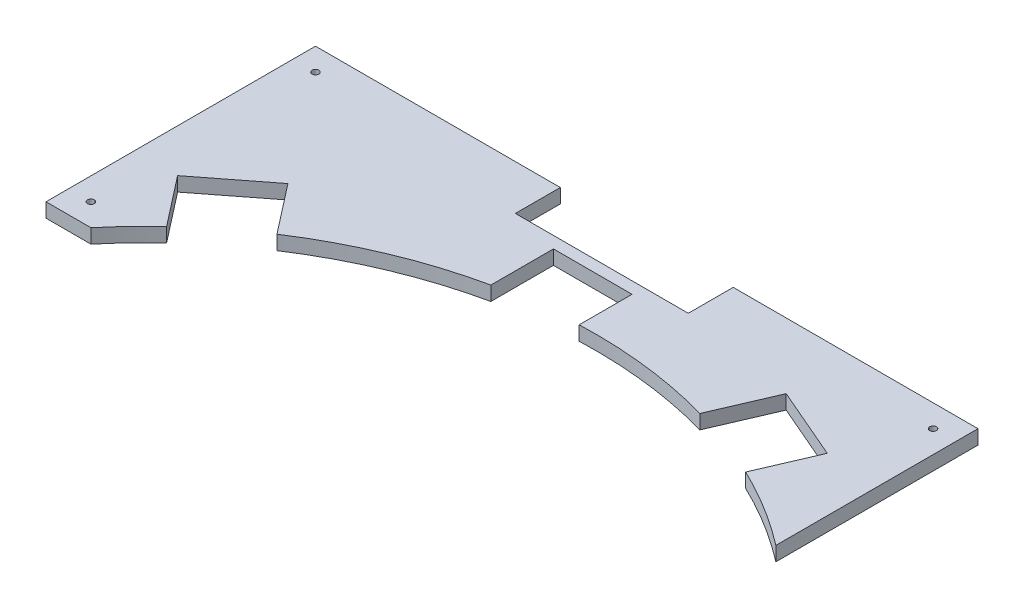
from build123d import *

# Parameters (mm, degrees)
SKETCH1_R           = 1.5
BOSS_EXTRUDE1_DEPTH = 6.35
SKETCH2_W           = 77
SKETCH2_H           = 20
CUT_EXTRUDE1_DEPTH  = 314.988757169


with BuildPart() as part:
    # Sketch1 → Boss-Extrude1 (new body)
    with BuildSketch(Plane(origin=(0, 0, 0), x_dir=(1, 0, 0), z_dir=(0, 1, 0))):
        with BuildLine():
            Line((-12.325393565, 51.903078107), (-32.325393565, 51.903078107))
            Line((-32.325393565, 51.903078107), (-32.325393565, 171.903078107))
            Line((-32.325393565, 171.903078107), (262.674606435, 171.903078107))
            Line((262.674606435, 171.903078107), (262.674606435, 81.903078107))
            ThreePointArc((262.674606435, 81.903078107), (245.726621464, 93.585795788), (227.667582408, 103.464621393))
            Line((227.667582408, 103.464621393), (238.603677752, 128.848011292))
            Line((238.603677752, 128.848011292), (206.460023967, 142.69667626))
            Line((206.460023967, 142.69667626), (194.894337427, 115.851964169))
            ThreePointArc((194.894337427, 115.851964169), (164.644985075, 121.873244601), (133.829525809, 123.171938578))
            Line((133.829525809, 123.171938578), (133.829525809, 146.700106226))
            Line((133.829525809, 146.700106226), (98.829525809, 146.700106226))
            Line((98.829525809, 146.700106226), (98.829525809, 118.832698551))
            ThreePointArc((98.829525809, 118.832698551), (63.926584878, 107.913888662), (31.595344572, 90.822177359))
            Line((31.595344572, 90.822177359), (14.511143678, 112.780590012))
            Line((14.511143678, 112.780590012), (-13.112869832, 91.288408234))
            Line((-13.112869832, 91.288408234), (4.06310254, 69.21204122))
            ThreePointArc((4.06310254, 69.21204122), (-4.389241508, 60.801930467), (-12.325393565, 51.903078107))
        make_face()
        with Locations((-22.325393565, 161.903078107)):
            Circle(SKETCH1_R, mode=Mode.SUBTRACT)
        with Locations((252.674606435, 161.903078107)):
            Circle(SKETCH1_R, mode=Mode.SUBTRACT)
        with Locations((-22.325393565, 61.903078107)):
            Circle(SKETCH1_R, mode=Mode.SUBTRACT)
    extrude(amount=BOSS_EXTRUDE1_DEPTH)

    # Sketch2 → Cut-Extrude1 (cut, through all)
    with BuildSketch(Plane(origin=(0, 6.35, 0), x_dir=(1, 0, 0), z_dir=(0, 1, 0))):
        with Locations((115.174606435, 161.903078107)):
            Rectangle(SKETCH2_W, SKETCH2_H)
    extrude(amount=-CUT_EXTRUDE1_DEPTH, mode=Mode.SUBTRACT)


solid = part.part
